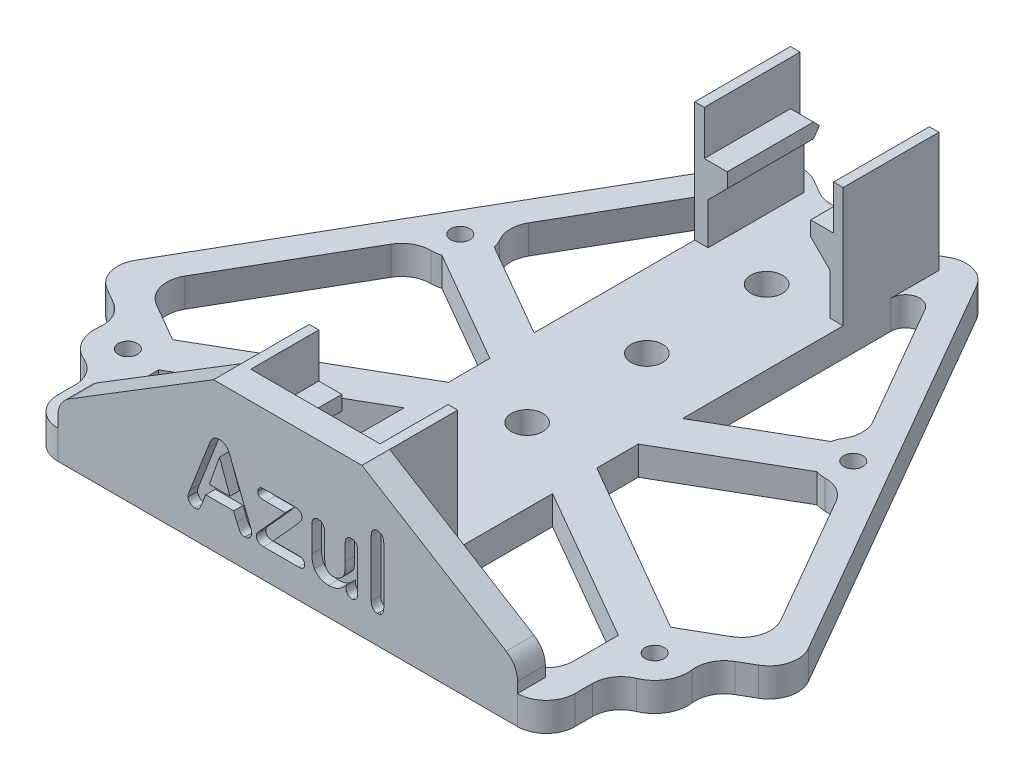
from build123d import *

# Parameters (mm, degrees)
SKETCH1_R                = 2
BOSS_EXTRUDE1_DEPTH      = 6
BOSS_EXTRUDE2_DEPTH      = 20
BOSS_EXTRUDE4_DEPTH      = 10
BOSS_EXTRUDE4_DEPTH_BACK = 10
BOSS_EXTRUDE4_START      = -110.498523
SKETCH4_R                = 3.3
CUT_EXTRUDE1_DEPTH       = 104.672467336
BOSS_EXTRUDE6_DEPTH      = 5.795554958
CUT_EXTRUDE2_DEPTH       = 2
CHAMFER1_SIZE            = 2


with BuildPart() as part:
    # Sketch1 → Boss-Extrude1 (new body)
    with BuildSketch(Plane(origin=(0, 0, 0), x_dir=(1, 0, 0), z_dir=(0, 1, 0))):
        with BuildLine():
            Line((-22.226291225, 68.257981064), (-70.226291225, -14.8804577))
            ThreePointArc((-70.226291225, -14.8804577), (-70.82569376, -19.43337197), (-68.030138802, -23.076610122))
            Line((-68.030138802, -23.076610122), (-64.892304845, -24.888239402))
            ThreePointArc((-64.892304845, -24.888239402), (-62.513847194, -27.42503226), (-61.942010301, -30.855102431))
            ThreePointArc((-61.942010301, -30.855102431), (-61.062177826, -35.254264805), (-57.692307692, -38.215803267))
            ThreePointArc((-57.692307692, -38.215803267), (-55.007698234, -40.426063628), (-54, -43.754264805))
            Line((-54, -43.754264805), (-54, -47.377523364))
            ThreePointArc((-54, -47.377523364), (-52.242640687, -51.620164051), (-48, -53.377523364))
            Line((-48, -53.377523364), (48, -53.377523364))
            ThreePointArc((48, -53.377523364), (52.242640687, -51.620164051), (54, -47.377523364))
            Line((54, -47.377523364), (54, -43.754264805))
            ThreePointArc((54, -43.754264805), (55.007698234, -40.426063628), (57.692307692, -38.215803267))
            ThreePointArc((57.692307692, -38.215803267), (61.062177826, -35.254264805), (61.942010301, -30.855102431))
            ThreePointArc((61.942010301, -30.855102431), (62.513847194, -27.42503226), (64.892304845, -24.888239402))
            Line((64.892304845, -24.888239402), (68.030138802, -23.076610122))
            ThreePointArc((68.030138802, -23.076610122), (70.82569376, -19.43337197), (70.226291225, -14.8804577))
            Line((70.226291225, -14.8804577), (22.226291225, 68.257981064))
            ThreePointArc((22.226291225, 68.257981064), (18.583053072, 71.053536022), (14.030138802, 70.454133486))
            Line((14.030138802, 70.454133486), (10.892304845, 68.642504207))
            ThreePointArc((10.892304845, 68.642504207), (7.50614896, 67.851095888), (4.249702609, 69.070905698))
            ThreePointArc((4.249702609, 69.070905698), (0, 70.508529611), (-4.249702609, 69.070905698))
            ThreePointArc((-4.249702609, 69.070905698), (-7.50614896, 67.851095888), (-10.892304845, 68.642504207))
            Line((-10.892304845, 68.642504207), (-14.030138802, 70.454133486))
            ThreePointArc((-14.030138802, 70.454133486), (-18.583053072, 71.053536022), (-22.226291225, 68.257981064))
        make_face()
        with Locations(Location((0, 63.508529611, 0), (0, 0, 270))):
            Circle(SKETCH1_R, mode=Mode.SUBTRACT)
        with Locations(Location((41.030138802, 23.688761682, 0), (0, 0, 270))):
            Circle(SKETCH1_R, mode=Mode.SUBTRACT)
        with Locations(Location((55, -31.754264805, 0), (0, 0, 270))):
            Circle(SKETCH1_R, mode=Mode.SUBTRACT)
        with Locations(Location((0, -47.377523364, 0), (0, 0, 270))):
            Circle(SKETCH1_R, mode=Mode.SUBTRACT)
        with Locations(Location((-55, -31.754264805, 0), (0, 0, 270))):
            Circle(SKETCH1_R, mode=Mode.SUBTRACT)
        with Locations(Location((-41.030138802, 23.688761682, 0), (0, 0, 270))):
            Circle(SKETCH1_R, mode=Mode.SUBTRACT)
        with BuildLine():
            Line((35.953348554, 32.890910414), (21.098076211, 58.620996873))
            ThreePointArc((21.098076211, 58.620996873), (17.723542865, 60.018774352), (15.5, 57.120996873))
            Line((15.5, 57.120996873), (15.5, 13.567731326))
            Line((15.5, 13.567731326), (35.157155456, 24.91679532))
            ThreePointArc((35.157155456, 24.91679532), (35.446314531, 25.884417965), (35.893667467, 26.789836048))
            ThreePointArc((35.893667467, 26.789836048), (36.756909086, 29.83222085), (35.953348554, 32.890910414))
        make_face(mode=Mode.SUBTRACT)
        with BuildLine():
            Line((62.207193402, -12.582082756), (46.46103825, 14.691057992))
            ThreePointArc((46.46103825, 14.691057992), (44.213915651, 16.916306608), (41.147512314, 17.689909837))
            ThreePointArc((41.147512314, 17.689909837), (40.139720785, 17.755199872), (39.157155456, 17.988592089))
            Line((39.157155456, 17.988592089), (15.5, 4.330127019))
            Line((15.5, 4.330127019), (15.5, -4.330127019))
            Line((15.5, -4.330127019), (52, -25.403411844))
            Line((52, -25.403411844), (60.011040979, -20.778235178))
            ThreePointArc((60.011040979, -20.778235178), (62.806595937, -17.134997026), (62.207193402, -12.582082756))
        make_face(mode=Mode.SUBTRACT)
        with BuildLine():
            Line((-21.098076211, 58.620996873), (-35.953348554, 32.890910414))
            ThreePointArc((-35.953348554, 32.890910414), (-36.756909086, 29.83222085), (-35.893667467, 26.789836048))
            ThreePointArc((-35.893667467, 26.789836048), (-35.446314531, 25.884417965), (-35.157155456, 24.91679532))
            Line((-35.157155456, 24.91679532), (-15.5, 13.567731326))
            Line((-15.5, 13.567731326), (-15.5, 57.120996873))
            ThreePointArc((-15.5, 57.120996873), (-17.723542865, 60.018774352), (-21.098076211, 58.620996873))
        make_face(mode=Mode.SUBTRACT)
        with BuildLine():
            Line((-46.46103825, 14.691057992), (-62.207193402, -12.582082756))
            ThreePointArc((-62.207193402, -12.582082756), (-62.806595937, -17.134997026), (-60.011040979, -20.778235178))
            Line((-60.011040979, -20.778235178), (-52, -25.403411844))
            Line((-52, -25.403411844), (-15.5, -4.330127019))
            Line((-15.5, -4.330127019), (-15.5, 4.330127019))
            Line((-15.5, 4.330127019), (-39.157155456, 17.988592089))
            ThreePointArc((-39.157155456, 17.988592089), (-40.139720785, 17.755199872), (-41.147512314, 17.689909837))
            ThreePointArc((-41.147512314, 17.689909837), (-44.213915651, 16.916306608), (-46.46103825, 14.691057992))
        make_face(mode=Mode.SUBTRACT)
        with BuildLine():
            Line((-48, -32.331615075), (-48, -41.581968407))
            ThreePointArc((-48, -41.581968407), (-46.242640687, -45.824609094), (-42, -47.581968407))
            Line((-42, -47.581968407), (-21.5, -47.581968407))
            ThreePointArc((-21.5, -47.581968407), (-17.257359313, -45.824609094), (-15.5, -41.581968407))
            Line((-15.5, -41.581968407), (-15.5, -13.567731326))
            Line((-15.5, -13.567731326), (-48, -32.331615075))
        make_face(mode=Mode.SUBTRACT)
        with BuildLine():
            Line((21.5, -47.581968407), (42, -47.581968407))
            ThreePointArc((42, -47.581968407), (46.242640687, -45.824609094), (48, -41.581968407))
            Line((48, -41.581968407), (48, -32.331615075))
            Line((48, -32.331615075), (15.5, -13.567731326))
            Line((15.5, -13.567731326), (15.5, -41.581968407))
            ThreePointArc((15.5, -41.581968407), (17.257359313, -45.824609094), (21.5, -47.581968407))
        make_face(mode=Mode.SUBTRACT)
    extrude(amount=BOSS_EXTRUDE1_DEPTH)

    # Sketch2 → Boss-Extrude2 (add)
    with BuildSketch(Plane.XY.offset(53.377523364)):
        Polygon((-15.5, 6), (-15.5, 31), (-13.5, 31), (-13.5, 21.75), (-8.7, 21.75), (-8.7, 18.706051224), (-12.7, 14.706051224), (-12.7, 6), align=None)
        Polygon((12.7, 14.706051224), (12.7, 6), (15.5, 6), (15.5, 31), (13.5, 31), (13.5, 21.75), (8.7, 21.75), (8.7, 18.706051224), align=None)
    extrude(amount=-BOSS_EXTRUDE2_DEPTH)

    # Sketch2<3> → Boss-Extrude4 (add, two sides: drawn at the far end of the back side and taken through both)
    with BuildSketch(Plane.XY.offset(53.377523364).offset(BOSS_EXTRUDE4_START - BOSS_EXTRUDE4_DEPTH_BACK)):
        Polygon((-15.5, 6), (-15.5, 31), (-13.5, 31), (-13.5, 21.75), (-8.7, 21.75), (-8.7, 18.706051224), (-12.7, 14.706051224), (-12.7, 6), align=None)
        Polygon((12.7, 14.706051224), (12.7, 6), (15.5, 6), (15.5, 31), (13.5, 31), (13.5, 21.75), (8.7, 21.75), (8.7, 18.706051224), align=None)
    extrude(amount=BOSS_EXTRUDE4_DEPTH + BOSS_EXTRUDE4_DEPTH_BACK)

    # Sketch4 → Cut-Extrude1 (cut, through all)
    with BuildSketch(Plane(origin=(0, 6, 0), x_dir=(1, 0, 0), z_dir=(0, 1, 0))):
        with Locations(Location((0, -28.377523364, 0), (0, 0, 270))):
            Circle(SKETCH4_R)
        with Locations(Location((0, -3.377523364, 0), (0, 0, 270))):
            Circle(SKETCH4_R)
        with Locations(Location((0, 21.622476636, 0), (0, 0, 270))):
            Circle(SKETCH4_R)
        with Locations(Location((0, 46.622476636, 0), (0, 0, 270))):
            Circle(SKETCH4_R)
    extrude(amount=-CUT_EXTRUDE1_DEPTH, mode=Mode.SUBTRACT)

    # Sketch9 → Boss-Extrude6 (add)
    with BuildSketch(Plane.XY.offset(53.377523364)):
        with BuildLine():
            Line((-48, 6), (-48, 8.20602403))
            ThreePointArc((-48, 8.20602403), (-47.364770077, 10.645036572), (-45.620487128, 12.464315613))
            Line((-45.620487128, 12.464315613), (-15.5, 31))
            Line((-15.5, 31), (15.5, 31))
            Line((15.5, 31), (45.620487128, 12.464315613))
            ThreePointArc((45.620487128, 12.464315613), (47.364770077, 10.645036572), (48, 8.20602403))
            Line((48, 8.20602403), (48, 6))
            Line((48, 6), (-48, 6))
        make_face()
    extrude(amount=-BOSS_EXTRUDE6_DEPTH)

    # Sketch10 → Cut-Extrude2 (cut)
    # profile 1 of 4: a face of its own
    with BuildSketch(Plane.XY.offset(53.377523364)):
        with BuildLine():
            Line((17.437499456, 7.472758251), (17.437499456, 19.185648876))
            add(Edge.make_bspline(
                [(17.437499456, 19.185648876), (17.441974561, 19.312874988), (17.450405119, 19.552553627), (17.513035009, 19.889854069), (17.623259189, 20.177925002), (17.77791488, 20.416394661), (17.972434117, 20.601662707), (18.198987369, 20.73723145), (18.458999025, 20.814691927), (18.641090595, 20.824253814), (18.735351019, 20.829203564)],
                knots=[0, 0, 0, 0, 1.288703139, 2.427761178, 3.458535653, 4.394326789, 5.283115668, 6.157020003, 7.04597409, 8, 8, 8, 8], degree=3))
            add(Edge.make_bspline(
                [(18.735351019, 20.829203564), (18.830607661, 20.824300983), (19.014652963, 20.81482871), (19.276683232, 20.736860473), (19.507146501, 20.60436426), (19.707685372, 20.421764547), (19.870930858, 20.18654263), (19.984680006, 19.897101029), (20.050497373, 19.557736289), (20.058331233, 19.314871716), (20.062499456, 19.185648876)],
                knots=[0, 0, 0, 0, 0.955145431, 1.845435904, 2.714968285, 3.603367108, 4.547172696, 5.563135651, 6.703398653, 8, 8, 8, 8], degree=3))
            Line((20.062499456, 19.185648876), (20.062499456, 7.472758251))
            add(Edge.make_bspline(
                [(20.062499456, 7.472758251), (20.058735398, 7.343444918), (20.051655387, 7.10021285), (19.980755926, 6.761776892), (19.868582964, 6.470964674), (19.701623609, 6.236270137), (19.499078052, 6.055829463), (19.270384206, 5.920655755), (19.010578787, 5.844329862), (18.82859958, 5.83432843), (18.735351019, 5.829203564)],
                knots=[0, 0, 0, 0, 1.298733371, 2.442854098, 3.460487619, 4.411490617, 5.308636561, 6.171085591, 7.062839985, 8, 8, 8, 8], degree=3))
            add(Edge.make_bspline(
                [(18.735351019, 5.829203564), (18.642923975, 5.833807857), (18.464135668, 5.842714274), (18.208908866, 5.925774294), (17.983468611, 6.06328925), (17.787175893, 6.251635837), (17.625622507, 6.489713482), (17.518049808, 6.779082057), (17.448994514, 7.111128375), (17.441485421, 7.347361411), (17.437499456, 7.472758251)],
                knots=[0, 0, 0, 0, 0.93838027, 1.815176741, 2.697978161, 3.604673965, 4.563818871, 5.599066837, 6.725540516, 8, 8, 8, 8], degree=3))
        make_face()
    # profile 2 of 4: a face of its own
    with BuildSketch(Plane.XY.offset(53.377523364)):
        with BuildLine():
            Line((12.15527331, 7.311371163), (12.15527331, 7.6541446))
            add(Edge.make_bspline(
                [(12.15527331, 7.6541446), (12.07428717, 7.556556438), (11.915200851, 7.364857691), (11.66233341, 7.09722253), (11.402664848, 6.854937698), (11.136929277, 6.636278923), (10.864736766, 6.439437019), (10.575042779, 6.276860948), (10.276210595, 6.134760056), (9.962600003, 6.019547849), (9.631276276, 5.930708542), (9.279039231, 5.871432404), (8.905222075, 5.831323904), (8.648550079, 5.827820574), (8.516601435, 5.8260196)],
                knots=[0, 0, 0, 0, 1.077213554, 2.116040354, 3.125733004, 4.092446053, 5.038610977, 5.975086391, 6.910384958, 7.84748497, 8.809486843, 9.820235676, 10.87943775, 12, 12, 12, 12], degree=3))
            add(Edge.make_bspline(
                [(8.516601435, 5.8260196), (8.357161782, 5.831433592), (8.044381871, 5.842054462), (7.587380104, 5.915208091), (7.156428, 6.04193191), (6.755125259, 6.217702469), (6.387777518, 6.436226074), (6.064071063, 6.697626708), (5.774935061, 6.989933501), (5.626265654, 7.217720168), (5.551757685, 7.331878975)],
                knots=[0, 0, 0, 0, 1.100659763, 2.159213586, 3.185386709, 4.19377494, 5.176617491, 6.126388902, 7.061010856, 8, 8, 8, 8], degree=3))
            add(Edge.make_bspline(
                [(5.551757685, 7.331878975), (5.512229752, 7.406398863), (5.430776742, 7.559957849), (5.33314125, 7.810939498), (5.246975861, 8.083603455), (5.182695527, 8.380355862), (5.124702939, 8.698428699), (5.088142584, 9.04011777), (5.068660739, 9.405865949), (5.064599993, 9.657050486), (5.062499872, 9.7869571)],
                knots=[0, 0, 0, 0, 0.799685433, 1.647867272, 2.550423266, 3.510135232, 4.526111565, 5.616776441, 6.767453979, 8, 8, 8, 8], degree=3))
            Line((5.062499872, 9.7869571), (5.062499872, 15.101410225))
            add(Edge.make_bspline(
                [(5.062499872, 15.101410225), (5.067136148, 15.226647282), (5.075898635, 15.46334335), (5.136437049, 15.794550121), (5.2493926, 16.075790878), (5.406327075, 16.306118439), (5.602426724, 16.485812483), (5.831557695, 16.609548273), (6.086383299, 16.690805122), (6.26692216, 16.697536234), (6.360351435, 16.7010196)],
                knots=[0, 0, 0, 0, 1.287996314, 2.434292762, 3.443239424, 4.382019993, 5.277808443, 6.149863178, 7.042549956, 8, 8, 8, 8], degree=3))
            add(Edge.make_bspline(
                [(6.360351435, 16.7010196), (6.455502078, 16.695773315), (6.639067853, 16.685652119), (6.902286053, 16.612531284), (7.131199871, 16.478781957), (7.331747916, 16.300165346), (7.496041184, 16.070489323), (7.608732057, 15.788390363), (7.675779918, 15.459025942), (7.683425137, 15.223833142), (7.687499872, 15.098480538)],
                knots=[0, 0, 0, 0, 0.96982084, 1.870990135, 2.753882516, 3.649259288, 4.591294098, 5.604447936, 6.723223282, 8, 8, 8, 8], degree=3))
            Line((7.687499872, 15.098480538), (7.687499872, 10.80648835))
            add(Edge.make_bspline(
                [(7.687499872, 10.80648835), (7.688423818, 10.656993813), (7.690195647, 10.370311667), (7.724611843, 9.958766701), (7.771792171, 9.584567239), (7.840823309, 9.246524016), (7.936439788, 8.943303294), (8.065113121, 8.67384435), (8.22801427, 8.439076451), (8.422786536, 8.238623852), (8.655687865, 8.08064146), (8.92556077, 7.968691168), (9.232044216, 7.90084441), (9.44884919, 7.892758363), (9.562499872, 7.8885196)],
                knots=[0, 0, 0, 0, 1.358767114, 2.605675635, 3.752183402, 4.786591833, 5.738481976, 6.635976532, 7.490681591, 8.325744213, 9.163069626, 10.030501431, 10.967575096, 12, 12, 12, 12], degree=3))
            add(Edge.make_bspline(
                [(9.562499872, 7.8885196), (9.677123189, 7.894001043), (9.904794054, 7.904888573), (10.241312818, 7.980277713), (10.566067211, 8.10884951), (10.876473808, 8.283296903), (11.162498561, 8.498007785), (11.410280896, 8.7485574), (11.617108087, 9.029713209), (11.717913057, 9.23733927), (11.76855456, 9.3416446)],
                knots=[0, 0, 0, 0, 0.985985338, 1.958415976, 2.950789168, 3.981548577, 5.013369089, 6.017482566, 7.004040568, 8, 8, 8, 8], degree=3))
            add(Edge.make_bspline(
                [(11.76855456, 9.3416446), (11.788271617, 9.395984869), (11.83193014, 9.51630789), (11.875934564, 9.724107954), (11.912820517, 9.97371428), (11.943869909, 10.265064299), (11.971012886, 10.598096448), (11.986587816, 10.973369811), (11.999458731, 11.391360358), (11.999813988, 11.684405279), (11.999999872, 11.83773835)],
                knots=[0, 0, 0, 0, 0.550679927, 1.219343839, 2.020083156, 2.956918232, 4.012527012, 5.205795046, 6.537957854, 8, 8, 8, 8], degree=3))
            Line((11.999999872, 11.83773835), (11.999999872, 15.098480538))
            add(Edge.make_bspline(
                [(11.999999872, 15.098480538), (12.004074568, 15.223833289), (12.011719714, 15.459026364), (12.078768057, 15.788388973), (12.191457352, 16.070493871), (12.355755917, 16.300149961), (12.5562855, 16.478836041), (12.784449737, 16.611853967), (13.045397425, 16.685779286), (13.227090849, 16.695816075), (13.321288935, 16.7010196)],
                knots=[0, 0, 0, 0, 1.279892668, 2.401398365, 3.417024787, 4.361358616, 5.258920538, 6.143967603, 7.037748896, 8, 8, 8, 8], degree=3))
            add(Edge.make_bspline(
                [(13.321288935, 16.7010196), (13.415708555, 16.697626035), (13.597250466, 16.69110118), (13.852993085, 16.60953376), (14.082219208, 16.485872475), (14.277346635, 16.306429915), (14.436277604, 16.077092298), (14.550687678, 15.796780158), (14.611986282, 15.464371995), (14.620474226, 15.227634925), (14.624999872, 15.101410225)],
                knots=[0, 0, 0, 0, 0.965643254, 1.856655665, 2.727074731, 3.621182997, 4.549963034, 5.570102879, 6.704414847, 8, 8, 8, 8], degree=3))
            Line((14.624999872, 15.101410225), (14.624999872, 7.33773835))
            add(Edge.make_bspline(
                [(14.624999872, 7.33773835), (14.621868916, 7.217296308), (14.615986688, 6.991017969), (14.551906124, 6.674494467), (14.443885737, 6.405021439), (14.293137355, 6.183320052), (14.10571427, 6.013639937), (13.891661504, 5.89478925), (13.654743723, 5.816529928), (13.486971784, 5.809262339), (13.400390497, 5.805511788)],
                knots=[0, 0, 0, 0, 1.3031517, 2.448273035, 3.477567788, 4.428200473, 5.32686198, 6.188856372, 7.065331508, 8, 8, 8, 8], degree=3))
            add(Edge.make_bspline(
                [(13.400390497, 5.805511788), (13.313825108, 5.809282779), (13.143919685, 5.816684258), (12.903099373, 5.89679945), (12.686006816, 6.022797871), (12.497564479, 6.197446848), (12.343741063, 6.417906275), (12.231191693, 6.680609918), (12.168719035, 6.98428144), (12.159901523, 7.19878214), (12.15527331, 7.311371163)],
                knots=[0, 0, 0, 0, 0.942845484, 1.850561313, 2.739968282, 3.668761993, 4.633806348, 5.656583732, 6.76996697, 8, 8, 8, 8], degree=3))
        make_face()
    # profile 3 of 4: a face of its own
    with BuildSketch(Plane.XY.offset(53.377523364)):
        with BuildLine():
            Line((1.924804918, 13.545932743), (-3.008788832, 8.073276493))
            Line((-3.008788832, 8.073276493), (2.270508043, 8.073276493))
            add(Edge.make_bspline(
                [(2.270508043, 8.073276493), (2.371397935, 8.070637252), (2.561278078, 8.065670061), (2.827192698, 8.00984367), (3.054487152, 7.91724453), (3.240029668, 7.785128495), (3.386035107, 7.626532185), (3.487711652, 7.441209318), (3.551570836, 7.236607257), (3.558804751, 7.092305978), (3.56250023, 7.018588993)],
                knots=[0, 0, 0, 0, 1.283919702, 2.416405184, 3.442575592, 4.388657961, 5.296057095, 6.16510038, 7.062632923, 8, 8, 8, 8], degree=3))
            add(Edge.make_bspline(
                [(3.56250023, 7.018588993), (3.558397329, 6.947943754), (3.550382988, 6.809949934), (3.492244868, 6.611435166), (3.383815036, 6.438369252), (3.243071303, 6.282761669), (3.057156628, 6.158881109), (2.830638084, 6.070728199), (2.563808965, 6.019275093), (2.372311258, 6.013726313), (2.270508043, 6.010776493)],
                knots=[0, 0, 0, 0, 0.916513354, 1.790257649, 2.648524737, 3.545118245, 4.49390242, 5.517321921, 6.680169007, 8, 8, 8, 8], degree=3))
            Line((2.270508043, 6.010776493), (-5.033202895, 6.010776493))
            add(Edge.make_bspline(
                [(-5.033202895, 6.010776493), (-5.153567115, 6.014314733), (-5.380463577, 6.020984605), (-5.69832987, 6.080267083), (-5.966900246, 6.185941273), (-6.18876296, 6.330471626), (-6.354938226, 6.518217287), (-6.478923503, 6.73261617), (-6.550365837, 6.980024974), (-6.558351707, 7.153873573), (-6.56249977, 7.24417493)],
                knots=[0, 0, 0, 0, 1.294646989, 2.440516117, 3.459144083, 4.383062955, 5.261017038, 6.131708653, 7.029562239, 8, 8, 8, 8], degree=3))
            add(Edge.make_bspline(
                [(-6.56249977, 7.24417493), (-6.558723449, 7.301144411), (-6.550970638, 7.418103149), (-6.498536801, 7.591591351), (-6.414289493, 7.765386909), (-6.314247381, 7.907826122), (-6.215697265, 8.032770822), (-6.119884618, 8.144378782), (-6.009694776, 8.276192424), (-5.880596967, 8.425466206), (-5.732904673, 8.592369189), (-5.571089273, 8.780795682), (-5.384080785, 8.980958602), (-5.257476503, 9.123755587), (-5.19140602, 9.198276493)],
                knots=[0, 0, 0, 0, 0.843414844, 1.731536494, 2.663118638, 3.694160692, 4.301839563, 5.020418296, 5.872348335, 6.846633684, 7.943359171, 9.173432467, 10.524910229, 12, 12, 12, 12], degree=3))
            add(Edge.make_bspline(
                [(-5.19140602, 9.198276493), (-5.046902079, 9.357480977), (-4.764869965, 9.668204527), (-4.350900513, 10.123367945), (-3.957216224, 10.554890919), (-3.467508249, 11.090612771), (-2.893323784, 11.71963813), (-2.344069232, 12.324732944), (-1.939480393, 12.776534593), (-1.668252724, 13.083406967), (-1.423535566, 13.362218292), (-1.204555043, 13.61774241), (-1.00677115, 13.848140882), (-0.833456162, 14.064264407), (-0.678775895, 14.260560177), (-0.585590329, 14.388443987), (-0.541991957, 14.448276493)],
                knots=[0, 0, 0, 0, 1.287276655, 2.512411466, 3.683665534, 4.784520393, 6.858009896, 8.782831597, 9.677227646, 10.489077017, 11.234911419, 11.898264819, 12.503914934, 13.052709621, 13.556794895, 14, 14, 14, 14], degree=3))
            Line((-0.541991957, 14.448276493), (-4.54687477, 14.448276493))
            add(Edge.make_bspline(
                [(-4.54687477, 14.448276493), (-4.676797894, 14.449537184), (-4.919455812, 14.451891781), (-5.259621526, 14.479725283), (-5.548322966, 14.530120168), (-5.79449661, 14.589167205), (-5.996997407, 14.704606285), (-6.136631192, 14.893522288), (-6.214684023, 15.144715201), (-6.221717007, 15.330471021), (-6.225585707, 15.432651493)],
                knots=[0, 0, 0, 0, 1.378470275, 2.57457421, 3.615406827, 4.487892749, 5.250242607, 6.033638734, 6.918344941, 8, 8, 8, 8], degree=3))
            add(Edge.make_bspline(
                [(-6.225585707, 15.432651493), (-6.22181049, 15.51118141), (-6.214567625, 15.661843384), (-6.154457875, 15.875962676), (-6.053508621, 16.065049548), (-5.909218604, 16.225449685), (-5.729052443, 16.355917465), (-5.511471007, 16.446437793), (-5.262635967, 16.502897258), (-5.085293108, 16.508063953), (-4.99218727, 16.510776493)],
                knots=[0, 0, 0, 0, 1.015207254, 1.947705206, 2.852719541, 3.7660833, 4.716910535, 5.707900981, 6.79663718, 8, 8, 8, 8], degree=3))
            Line((-4.99218727, 16.510776493), (1.19531273, 16.510776493))
            add(Edge.make_bspline(
                [(1.19531273, 16.510776493), (1.330149709, 16.50704615), (1.584129882, 16.500019643), (1.941491611, 16.458122227), (2.247055554, 16.370819306), (2.508449668, 16.260641211), (2.722887394, 16.102521372), (2.87127113, 15.882776722), (2.956404636, 15.611489365), (2.965722998, 15.414753475), (2.970703355, 15.309604618)],
                knots=[0, 0, 0, 0, 1.320440648, 2.487194138, 3.510092406, 4.421497899, 5.253218846, 6.077878093, 6.972689113, 8, 8, 8, 8], degree=3))
            add(Edge.make_bspline(
                [(2.970703355, 15.309604618), (2.965777929, 15.232948241), (2.955563182, 15.073972033), (2.884294596, 14.844663561), (2.795651529, 14.632663948), (2.686063434, 14.442535347), (2.544060001, 14.26490505), (2.377893336, 14.058348252), (2.165371593, 13.816233559), (2.009879956, 13.641523092), (1.924804918, 13.545932743)],
                knots=[0, 0, 0, 0, 0.87583533, 1.816378314, 2.727200703, 3.503097911, 4.316290601, 5.324632212, 6.53621054, 8, 8, 8, 8], degree=3))
        make_face()
    # profile 4 of 4: a face of its own
    with BuildSketch(Plane.XY.offset(53.377523364)):
        with BuildLine():
            Line((-10.602538333, 7.632932299), (-11.288085208, 9.381955736))
            Line((-11.288085208, 9.381955736), (-17.121093021, 9.381955736))
            Line((-17.121093021, 9.381955736), (-17.806639896, 7.594846361))
            add(Edge.make_bspline(
                [(-17.806639896, 7.594846361), (-17.869589176, 7.434075099), (-17.984965027, 7.139407375), (-18.163792398, 6.744205403), (-18.325886426, 6.432768406), (-18.476195695, 6.19089461), (-18.651518968, 6.012564505), (-18.871362639, 5.898314449), (-19.133743975, 5.831026226), (-19.322790177, 5.823485784), (-19.423827396, 5.819455736)],
                knots=[0, 0, 0, 0, 1.589179946, 2.912709847, 3.990397165, 4.820646782, 5.526248733, 6.26234321, 7.071295771, 8, 8, 8, 8], degree=3))
            add(Edge.make_bspline(
                [(-19.423827396, 5.819455736), (-19.513280043, 5.824496741), (-19.689684604, 5.834437824), (-19.944664689, 5.915137526), (-20.182701572, 6.043832349), (-20.398650541, 6.217786865), (-20.581026135, 6.4232051), (-20.713185512, 6.651584301), (-20.797943238, 6.893681366), (-20.807626821, 7.061941434), (-20.812499271, 7.146604174)],
                knots=[0, 0, 0, 0, 1.012468346, 1.996632184, 3.002236258, 4.065667855, 5.124941345, 6.097262832, 7.042607408, 8, 8, 8, 8], degree=3))
            add(Edge.make_bspline(
                [(-20.812499271, 7.146604174), (-20.807983494, 7.247602514), (-20.798707247, 7.455071928), (-20.73272353, 7.716691759), (-20.653502189, 7.942882657), (-20.580304898, 8.148022465), (-20.493363139, 8.385108496), (-20.426264814, 8.552063496), (-20.390624271, 8.640744799)],
                knots=[0, 0, 0, 0, 1.162779838, 2.388566498, 3.08974091, 3.926345762, 4.898539362, 6, 6, 6, 6], degree=3))
            Line((-20.390624271, 8.640744799), (-16.719725833, 18.059690111))
            add(Edge.make_bspline(
                [(-16.719725833, 18.059690111), (-16.692582228, 18.131056804), (-16.635976306, 18.279886608), (-16.542965445, 18.512058706), (-16.448555791, 18.766247741), (-16.344718958, 19.033086831), (-16.239056589, 19.300337669), (-16.120090393, 19.54792798), (-16.005300018, 19.775232184), (-15.880674785, 19.977631295), (-15.744906721, 20.160386743), (-15.589321371, 20.321802595), (-15.412996021, 20.463443171), (-15.219952433, 20.591480354), (-15.002365618, 20.694185567), (-14.760786319, 20.767818862), (-14.495745738, 20.81179145), (-14.31071996, 20.816839783), (-14.214843021, 20.819455736)],
                knots=[0, 0, 0, 0, 0.906149852, 1.889706515, 2.96811083, 4.12389095, 5.288239382, 6.376994434, 7.382631969, 8.308939681, 9.194397083, 10.07962691, 10.961131357, 11.874074475, 12.822804478, 13.805267996, 14.862730428, 16, 16, 16, 16], degree=3))
            add(Edge.make_bspline(
                [(-14.214843021, 20.819455736), (-14.117977837, 20.816866367), (-13.93098833, 20.811867822), (-13.663230652, 20.767504102), (-13.419827112, 20.695709973), (-13.204163047, 20.590203834), (-13.009732341, 20.465890679), (-12.832805963, 20.326528849), (-12.678909174, 20.16544793), (-12.500630381, 19.929194671), (-12.308831244, 19.60902238), (-12.148366775, 19.263488673), (-12.032014989, 18.959385834), (-11.923186975, 18.698792796), (-11.81125334, 18.399627557), (-11.731506805, 18.188569761), (-11.689452396, 18.077268236)],
                knots=[0, 0, 0, 0, 1.005463131, 1.940955953, 2.810500616, 3.631666672, 4.42517864, 5.204561669, 5.964968357, 6.731842121, 8.274852444, 9.831306624, 10.68267648, 11.656482744, 12.764143998, 14, 14, 14, 14], degree=3))
            Line((-11.689452396, 18.077268236), (-7.939452396, 8.719846361))
            add(Edge.make_bspline(
                [(-7.939452396, 8.719846361), (-7.905172242, 8.633959961), (-7.839160435, 8.468572244), (-7.745796836, 8.229810185), (-7.676188033, 8.005866832), (-7.606948176, 7.80397982), (-7.562741078, 7.616911586), (-7.526044337, 7.450349139), (-7.50336531, 7.301535889), (-7.501077839, 7.208194026), (-7.499999271, 7.164182299)],
                knots=[0, 0, 0, 0, 1.36622511, 2.630880465, 3.785062113, 4.829837655, 5.781525877, 6.621841003, 7.350182692, 8, 8, 8, 8], degree=3))
            add(Edge.make_bspline(
                [(-7.499999271, 7.164182299), (-7.505387127, 7.081625275), (-7.516200453, 6.915934867), (-7.59542043, 6.672785472), (-7.732958415, 6.445242836), (-7.911159449, 6.231883044), (-8.125581642, 6.048924438), (-8.370978094, 5.915964783), (-8.637392692, 5.834014081), (-8.82364131, 5.824350111), (-8.917968021, 5.819455736)],
                knots=[0, 0, 0, 0, 0.918533131, 1.843478885, 2.81316186, 3.862812883, 4.927781559, 5.930017069, 6.951644948, 8, 8, 8, 8], degree=3))
            add(Edge.make_bspline(
                [(-8.917968021, 5.819455736), (-9.025113812, 5.824163697), (-9.226983441, 5.833033801), (-9.506132384, 5.923105873), (-9.73489123, 6.070271152), (-9.896596846, 6.227649367), (-10.007844218, 6.384600831), (-10.095370449, 6.528774034), (-10.18580868, 6.699204623), (-10.306243256, 6.954145462), (-10.441802345, 7.269910589), (-10.551555617, 7.517787999), (-10.602538333, 7.632932299)],
                knots=[0, 0, 0, 0, 1.202315025, 2.265239587, 3.252603888, 4.239051274, 4.781746036, 5.412840692, 6.135219166, 6.950797606, 8.583580985, 10, 10, 10, 10], degree=3))
        make_face()
        Polygon((-16.359374271, 11.631955736), (-12.070311771, 11.631955736), (-14.235350833, 17.631955736), align=None, mode=Mode.SUBTRACT)
    extrude(amount=-CUT_EXTRUDE2_DEPTH, mode=Mode.SUBTRACT)

    # Chamfer1
    # the kernel refuses this chamfer: 2 mm, written as the material it takes off along each edge
    with BuildSketch(Plane(origin=(-5.06309104, 22.342960184, -67.120999636), x_dir=(-0.7068394360706773, 0.7068394360706696, -0.02749587661058907), z_dir=(-0.7071067811865437, -0.7071067811865515, 0))) as chamfer1_piece_1_section:
        Polygon((CHAMFER1_SIZE * 0.999621916911, -CHAMFER1_SIZE * 0.0274958766106), (-CHAMFER1_SIZE * 0.0274958766106, -CHAMFER1_SIZE * 0.999621916911), (0, 0), align=None)
    chamfer1_piece_1 = extrude(amount=15.943586201, mode=Mode.PRIVATE)
    chamfer1_piece_1 = split(chamfer1_piece_1, bisect_by=Plane(origin=(-12.7, 17.648860266, -66.454332969), z_dir=(1, 0, 0)), keep=Keep.TOP, mode=Mode.PRIVATE)
    add(chamfer1_piece_1, mode=Mode.SUBTRACT)
    with BuildSketch(Plane(origin=(-13.5, 21.75, -67.120999636), x_dir=(0, -0.9996219169112968, -0.0274958766105891), z_dir=(1, 0, 0))) as chamfer1_piece_2:
        Polygon((CHAMFER1_SIZE * 0.999621916911, -CHAMFER1_SIZE * 0.0274958766106), (-CHAMFER1_SIZE * 0.0274958766106, -CHAMFER1_SIZE * 0.999621916911), (0, 0), align=None)
    extrude(amount=9.943365976, mode=Mode.SUBTRACT)
    with BuildSketch(Plane(origin=(13.5, 21.75, -67.120999636), x_dir=(0, -0.9996219169112968, -0.0274958766105891), z_dir=(-1, 0, 0))) as chamfer1_piece_3:
        Polygon((CHAMFER1_SIZE * 0.999621916911, CHAMFER1_SIZE * 0.0274958766106), (-CHAMFER1_SIZE * 0.0274958766106, CHAMFER1_SIZE * 0.999621916911), (0, 0), align=None)
    extrude(amount=9.943365976, mode=Mode.SUBTRACT)
    with BuildSketch(Plane(origin=(5.06309104, 22.342960184, -67.120999636), x_dir=(0.7068394360706773, 0.7068394360706696, -0.02749587661058907), z_dir=(0.7071067811865437, -0.7071067811865515, 0))) as chamfer1_piece_4_section:
        Polygon((CHAMFER1_SIZE * 0.999621916911, CHAMFER1_SIZE * 0.0274958766106), (-CHAMFER1_SIZE * 0.0274958766106, CHAMFER1_SIZE * 0.999621916911), (0, 0), align=None)
    chamfer1_piece_4 = extrude(amount=15.943586201, mode=Mode.PRIVATE)
    chamfer1_piece_4 = split(chamfer1_piece_4, bisect_by=Plane(origin=(12.7, 17.648860266, -66.454332969), z_dir=(-1, 0, 0)), keep=Keep.TOP, mode=Mode.PRIVATE)
    add(chamfer1_piece_4, mode=Mode.SUBTRACT)


solid = part.part
